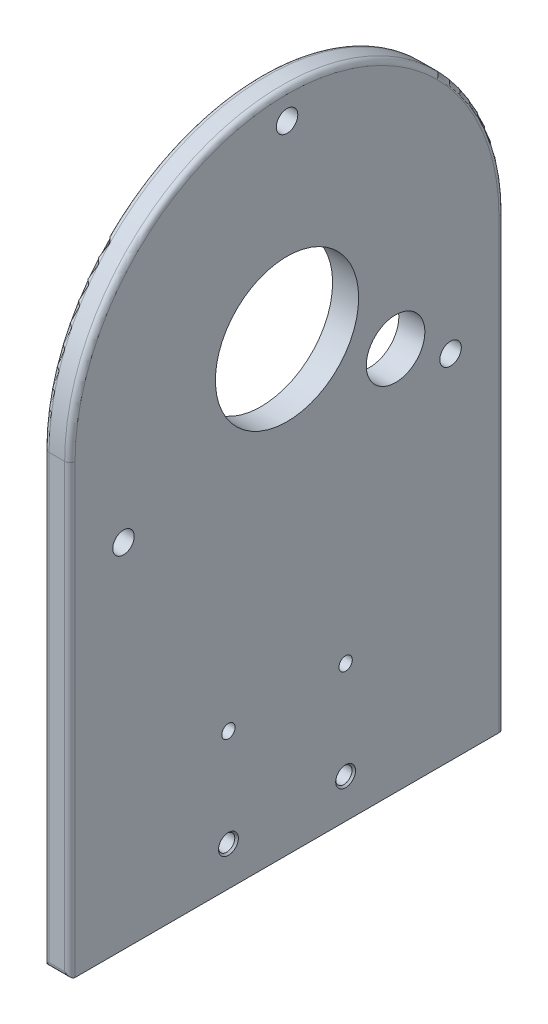
from build123d import *

# Parameters (mm, degrees)
SKETCH_1_W                   = 40
SKETCH_1_H                   = 66.7
EXTRUDE_1_DEPTH              = 2
SKETCH_2_W                   = 4
SKETCH_2_H                   = 66.7
EXTRUDE_2_DEPTH              = 100
CUT_EXTRUDE_1_DEPTH          = 115.526077816
CUT_EXTRUDE_1_DEPTH_BACK     = 115.526077816
HOLE_WIZARD_M4_1_D           = 3.3
HOLE_WIZARD_M4_1_CSINK_D     = 4.05
HOLE_WIZARD_M4_1_CSINK_ANGLE = 90
HOLE_WIZARD_M4_2_AT_2_COUNT  = 2
HOLE_WIZARD_M4_2_AT_2_PITCH  = 68.59294731
HOLE_WIZARD_M4_2_AT_3_COUNT  = 2
HOLE_WIZARD_M4_2_AT_3_PITCH  = 26
HOLE_WIZARD_M4_2_AT_4_COUNT  = 2
HOLE_WIZARD_M4_2_AT_4_PITCH  = 62.376998966
HOLE_WIZARD_M4_2_AT_5_COUNT  = 2
HOLE_WIZARD_M4_2_AT_5_PITCH  = 56.7
SKETCH_11_W                  = 66.7
SKETCH_11_H                  = 2
EXTRUDE_3_DEPTH              = 100
SKETCH_13_W                  = 40
SKETCH_13_H                  = 66.7
EXTRUDE_4_DEPTH              = 2
SKETCH_14_W                  = 4
SKETCH_14_H                  = 66.7
EXTRUDE_5_DEPTH              = 100
CUT_EXTRUDE_2_DEPTH          = 180.589037806
CUT_EXTRUDE_2_DEPTH_BACK     = 180.589037806
HOLE_WIZARD_M4_3_AT_2_COUNT  = 2
HOLE_WIZARD_M4_3_AT_2_PITCH  = 26
HOLE_WIZARD_M4_3_AT_3_COUNT  = 2
HOLE_WIZARD_M4_3_AT_3_PITCH  = 62.376998966
HOLE_WIZARD_M4_3_AT_4_COUNT  = 2
HOLE_WIZARD_M4_3_AT_4_PITCH  = 56.7
CUT_EXTRUDE_3_REACH          = 181.589
SKETCH_18_R                  = 9.5
CUT_EXTRUDE_4_REACH          = 181.589
SKETCH_21_R                  = 11
CUT_EXTRUDE_5_REACH          = 181.589
SKETCH_22_R                  = 4.5
FILLET_1_R                   = 2
CUT_EXTRUDE_6_REACH          = 193.604
SKETCH_23_W                  = 36
SKETCH_23_H                  = 66.7
CUT_EXTRUDE_7_REACH          = 164.752
SKETCH_24_W                  = 36
SKETCH_24_H                  = 66.7
HOLE_START                   = -124
HOLE_WIZARD_M3_1_OUTLINE_R   = 1.25
HOLE_WIZARD_M3_1_DEPTH       = 4
CUT_EXTRUDE_8_DEPTH          = 154.990981879
CUT_EXTRUDE_8_DEPTH_BACK     = 154.990981879
SKETCH_27_W                  = 104
SKETCH_27_H                  = 66.7
FILLET_2_R                   = 0.8


# Read off the part's stored shape, not the designer's step: M3 螺纹孔1, M2.5 螺纹孔1
with BuildPart() as part:
    # 草图1 → 凸台-拉伸1 (new body)
    with BuildSketch(Plane(origin=(0, 0, 0), x_dir=(1, 0, 0), z_dir=(0, 1, 0))):
        Rectangle(SKETCH_1_W, SKETCH_1_H)
    extrude(amount=EXTRUDE_1_DEPTH)

    # 草图2 → 凸台-拉伸2 (add)
    with BuildSketch(Plane(origin=(0, 2, 0), x_dir=(1, 0, 0), z_dir=(0, 1, 0))):
        with Locations((-18, 0)):
            Rectangle(SKETCH_2_W, SKETCH_2_H)
    extrude(amount=EXTRUDE_2_DEPTH)

    # 草图5 → 切除-拉伸1 (cut, two sides: drawn at the far end of the back side and taken through both)
    with BuildSketch(Plane.ZY.offset(20).offset(-CUT_EXTRUDE_1_DEPTH_BACK)):
        with BuildLine():
            ThreePointArc((0, 102), (23.582011153, 92.232011153), (33.35, 68.65))
            Line((33.35, 68.65), (33.35, 102))
            Line((33.35, 102), (0, 102))
        make_face()
        with BuildLine():
            ThreePointArc((-33.35, 68.65), (-23.582011153, 92.232011153), (0, 102))
            Line((0, 102), (-33.35, 102))
            Line((-33.35, 102), (-33.35, 68.65))
        make_face()
    extrude(amount=CUT_EXTRUDE_1_DEPTH + CUT_EXTRUDE_1_DEPTH_BACK, mode=Mode.SUBTRACT)

    # M4 螺纹孔1 (through all)
    with Locations(Plane.ZY.offset(20)):
        with Locations((0, 97.65), (25.11473671, 54.15), (-25.11473671, 54.15)):
            CounterSinkHole(HOLE_WIZARD_M4_1_D / 2, HOLE_WIZARD_M4_1_CSINK_D / 2, counter_sink_angle=HOLE_WIZARD_M4_1_CSINK_ANGLE)

    # 草图10 → M4 螺纹孔2 (revolve, cut)
    with BuildSketch(Plane(origin=(15, 2, -28.35), x_dir=(0, 0, 1), z_dir=(1, 0, 0))):
        Polygon((0, 0), (0, 2), (1.65, 2), (1.65, 0.375), (2.025, 0), align=None)
    hole_wizard_m4_2 = revolve(axis=Axis((15, 8.35, -28.35), (0, -1, 0)), mode=Mode.SUBTRACT)

    # M4 螺纹孔2 at 2: M4 螺纹孔2 ×2
    with Locations(*[Vector(-0.9508085645250022, 0, 0.3097790722852413) * (i * HOLE_WIZARD_M4_2_AT_2_PITCH) for i in range(1, HOLE_WIZARD_M4_2_AT_2_COUNT)]):
        add(hole_wizard_m4_2, mode=Mode.SUBTRACT)

    # M4 螺纹孔2 at 3: M4 螺纹孔2 ×2
    with Locations(*[(-i * HOLE_WIZARD_M4_2_AT_3_PITCH, 0, 0) for i in range(1, HOLE_WIZARD_M4_2_AT_3_COUNT)]):
        add(hole_wizard_m4_2, mode=Mode.SUBTRACT)

    # M4 螺纹孔2 at 4: M4 螺纹孔2 ×2
    with Locations(*[Vector(-0.4168203092647413, 0, 0.9089889052042635) * (i * HOLE_WIZARD_M4_2_AT_4_PITCH) for i in range(1, HOLE_WIZARD_M4_2_AT_4_COUNT)]):
        add(hole_wizard_m4_2, mode=Mode.SUBTRACT)

    # M4 螺纹孔2 at 5: M4 螺纹孔2 ×2
    with Locations(*[(0, 0, i * HOLE_WIZARD_M4_2_AT_5_PITCH) for i in range(1, HOLE_WIZARD_M4_2_AT_5_COUNT)]):
        add(hole_wizard_m4_2, mode=Mode.SUBTRACT)

    # 草图11 → 凸台-拉伸3 (add)
    with BuildSketch(Plane.ZY.offset(20)):
        with Locations((0, 16)):
            Rectangle(SKETCH_11_W, SKETCH_11_H)
    extrude(amount=EXTRUDE_3_DEPTH)



with BuildPart() as body_2:
    # 草图13 → 凸台-拉伸4 (new body)
    with BuildSketch(Plane(origin=(0, 0, 0), x_dir=(1, 0, 0), z_dir=(0, 1, 0))):
        with Locations((-140, 0)):
            Rectangle(SKETCH_13_W, SKETCH_13_H)
    extrude(amount=EXTRUDE_4_DEPTH)


with BuildPart() as part_1:
    add(part.part)

    add(body_2.part)  # 凸台-拉伸5 merges body 2
    # 草图14 → 凸台-拉伸5 (add)
    with BuildSketch(Plane(origin=(0, 2, 0), x_dir=(1, 0, 0), z_dir=(0, 1, 0))):
        with Locations((-122, 0)):
            Rectangle(SKETCH_14_W, SKETCH_14_H)
    extrude(amount=EXTRUDE_5_DEPTH)

    # 草图15 → 切除-拉伸2 (cut, two sides: drawn at the far end of the back side and taken through both)
    with BuildSketch(Plane.ZY.offset(124).offset(-CUT_EXTRUDE_2_DEPTH_BACK)):
        with BuildLine():
            ThreePointArc((0, 102), (23.582011153, 92.232011153), (33.35, 68.65))
            Line((33.35, 68.65), (33.35, 102))
            Line((33.35, 102), (0, 102))
        make_face()
        with BuildLine():
            ThreePointArc((-33.35, 68.65), (-23.582011153, 92.232011153), (0, 102))
            Line((0, 102), (-33.35, 102))
            Line((-33.35, 102), (-33.35, 68.65))
        make_face()
    extrude(amount=CUT_EXTRUDE_2_DEPTH + CUT_EXTRUDE_2_DEPTH_BACK, mode=Mode.SUBTRACT)

    # 草图17 → M4 螺纹孔3 (revolve, cut)
    with BuildSketch(Plane(origin=(-129, 2, -28.35), x_dir=(0, 0, 1), z_dir=(1, 0, 0))):
        Polygon((0, 0), (0, 2), (1.65, 2), (1.65, 0.375), (2.025, 0), align=None)
    hole_wizard_m4_3 = revolve(axis=Axis((-129, 8.35, -28.35), (0, -1, 0)), mode=Mode.SUBTRACT)

    # M4 螺纹孔3 at 2: M4 螺纹孔3 ×2
    with Locations(*[(-i * HOLE_WIZARD_M4_3_AT_2_PITCH, 0, 0) for i in range(1, HOLE_WIZARD_M4_3_AT_2_COUNT)]):
        add(hole_wizard_m4_3, mode=Mode.SUBTRACT)

    # M4 螺纹孔3 at 3: M4 螺纹孔3 ×2
    with Locations(*[Vector(-0.41682030926474106, 0, 0.9089889052042636) * (i * HOLE_WIZARD_M4_3_AT_3_PITCH) for i in range(1, HOLE_WIZARD_M4_3_AT_3_COUNT)]):
        add(hole_wizard_m4_3, mode=Mode.SUBTRACT)

    # M4 螺纹孔3 at 4: M4 螺纹孔3 ×2
    with Locations(*[(0, 0, i * HOLE_WIZARD_M4_3_AT_4_PITCH) for i in range(1, HOLE_WIZARD_M4_3_AT_4_COUNT)]):
        add(hole_wizard_m4_3, mode=Mode.SUBTRACT)

    # 草图18 → 切除-拉伸3 (cut, up to next)
    with BuildSketch(Plane.ZY.offset(124), mode=Mode.PRIVATE) as cut_extrude_3_sk1:
        with Locations((0, 68.65)):
            Circle(SKETCH_18_R)
    cut_extrude_3_tool1 = extrude(cut_extrude_3_sk1.sketch, amount=-CUT_EXTRUDE_3_REACH, mode=Mode.PRIVATE) & part_1.part
    add(cut_extrude_3_tool1.solids().sort_by_distance((-124, 68.65, 0))[0], mode=Mode.SUBTRACT)

    # 草图21 → 切除-拉伸4 (cut, up to next)
    with BuildSketch(Plane(origin=(-16, 0, 0), x_dir=(0, 0, -1), z_dir=(1, 0, 0)), mode=Mode.PRIVATE) as cut_extrude_4_sk1:
        with Locations((0, 68.65)):
            Circle(SKETCH_21_R)
    cut_extrude_4_tool1 = extrude(cut_extrude_4_sk1.sketch, amount=-CUT_EXTRUDE_4_REACH, mode=Mode.PRIVATE) & part_1.part
    add(cut_extrude_4_tool1.solids().sort_by_distance((-16, 68.65, 0))[0], mode=Mode.SUBTRACT)

    # 草图22 → 切除-拉伸5 (cut, up to next)
    with BuildSketch(Plane(origin=(-16, 0, 0), x_dir=(0, 0, -1), z_dir=(1, 0, 0)), mode=Mode.PRIVATE) as cut_extrude_5_sk1:
        with Locations((16.670989023, 59.025)):
            Circle(SKETCH_22_R)
    cut_extrude_5_tool1 = extrude(cut_extrude_5_sk1.sketch, amount=-CUT_EXTRUDE_5_REACH, mode=Mode.PRIVATE) & part_1.part
    add(cut_extrude_5_tool1.solids().sort_by_distance((-16, 59.025, -16.670989))[0], mode=Mode.SUBTRACT)

    # 圆角1
    fillet_1_edges = [part_1.edges().sort_by_distance(p)[0] for p in [
        (-160, 1, -33.35),
        (-160, 1, 33.35),
        (20, 1, 33.35),
        (20, 1, -33.35),
    ]]
    fillet(fillet_1_edges, radius=FILLET_1_R)

    # 草图23 → 切除-拉伸6 (cut, up to next)
    with BuildSketch(Plane(origin=(0, 2, 0), x_dir=(1, 0, 0), z_dir=(0, 1, 0)), mode=Mode.PRIVATE) as cut_extrude_6_sk1:
        with Locations((-142, 0)):
            Rectangle(SKETCH_23_W, SKETCH_23_H)
    cut_extrude_6_tool1 = extrude(cut_extrude_6_sk1.sketch, amount=-CUT_EXTRUDE_6_REACH, mode=Mode.PRIVATE) & part_1.part
    add(cut_extrude_6_tool1.solids().sort_by_distance((-142, 2, 0))[0], mode=Mode.SUBTRACT)

    # 草图24 → 切除-拉伸7 (cut, up to next)
    with BuildSketch(Plane(origin=(0, 2, 0), x_dir=(1, 0, 0), z_dir=(0, 1, 0)), mode=Mode.PRIVATE) as cut_extrude_7_sk1:
        with Locations((2, 0)):
            Rectangle(SKETCH_24_W, SKETCH_24_H)
    cut_extrude_7_tool1 = extrude(cut_extrude_7_sk1.sketch, amount=-CUT_EXTRUDE_7_REACH, mode=Mode.PRIVATE) & part_1.part
    add(cut_extrude_7_tool1.solids().sort_by_distance((2, 2, 0))[0], mode=Mode.SUBTRACT)

    # M3 螺纹孔1 outline → M3 螺纹孔1 (cut)
    with BuildSketch(Plane.YZ.offset(HOLE_START)):
        with Locations((6, -9)):
            Circle(HOLE_WIZARD_M3_1_OUTLINE_R)
        with Locations((6, 9)):
            Circle(HOLE_WIZARD_M3_1_OUTLINE_R)
    extrude(amount=HOLE_WIZARD_M3_1_DEPTH, mode=Mode.SUBTRACT)

    # Hole Wizard M3 _1 2 outline → Hole Wizard M3 _1 2 (revolve, cut)
    with BuildSketch(Plane(origin=(0, 6, -9), x_dir=(0, 1, 0), z_dir=(0, 0, -1))):
        Polygon((1.525, -16), (0, -16), (0, -20), (1.25, -20), (1.25, -16.275), align=None)
    revolve(axis=Axis((0, 6, -9), (1, 0, 0)), mode=Mode.SUBTRACT)

    # Hole Wizard M3 _1 3 outline → Hole Wizard M3 _1 3 (revolve, cut)
    with BuildSketch(Plane(origin=(0, 6, 9), x_dir=(0, 1, 0), z_dir=(0, 0, -1))):
        Polygon((0, -20), (1.25, -20), (1.25, -16.275), (1.525, -16), (0, -16), align=None)
    revolve(axis=Axis((0, 6, 9), (1, 0, 0)), mode=Mode.SUBTRACT)

    # 草图27 → 切除-拉伸8 (cut, two sides: drawn at the far end of the back side and taken through both)
    with BuildSketch(Plane(origin=(0, 17, 0), x_dir=(1, 0, 0), z_dir=(0, 1, 0)).offset(-CUT_EXTRUDE_8_DEPTH_BACK)):
        with Locations((-72, 0)):
            Rectangle(SKETCH_27_W, SKETCH_27_H)
    extrude(amount=CUT_EXTRUDE_8_DEPTH + CUT_EXTRUDE_8_DEPTH_BACK, mode=Mode.SUBTRACT)

    # M2.5 螺纹孔1 outline → M2.5 螺纹孔1 (revolve, cut)
    with BuildSketch(Plane(origin=(0, 21, -9), x_dir=(0, 1, 0), z_dir=(0, 0, -1))):
        Polygon((1.025, -19.75), (1.025, -16), (0, -16), (0, -20), (1.275, -20), align=None)
    revolve(axis=Axis((0, 21, -9), (1, 0, 0)), mode=Mode.SUBTRACT)

    # Hole Wizard M2.5 _1 2 outline → Hole Wizard M2.5 _1 2 (revolve, cut)
    with BuildSketch(Plane(origin=(0, 21, 9), x_dir=(0, 1, 0), z_dir=(0, 0, -1))):
        Polygon((1.025, -19.75), (1.025, -16), (0, -16), (0, -20), (1.275, -20), align=None)
    revolve(axis=Axis((0, 21, 9), (1, 0, 0)), mode=Mode.SUBTRACT)

    # 圆角2
    fillet_2_edges = [part_1.edges().sort_by_distance(p)[0] for p in [
        (-16, 34.325, -33.35),
        (-20, 34.325, -33.35),
        (-20, 102, 0),
        (-16, 102, 0),
        (-16, 34.325, 33.35),
        (-20, 34.325, 33.35),
        (-18, 0, 33.35),
    ]]
    fillet(fillet_2_edges, radius=FILLET_2_R)


solid = part_1.part
